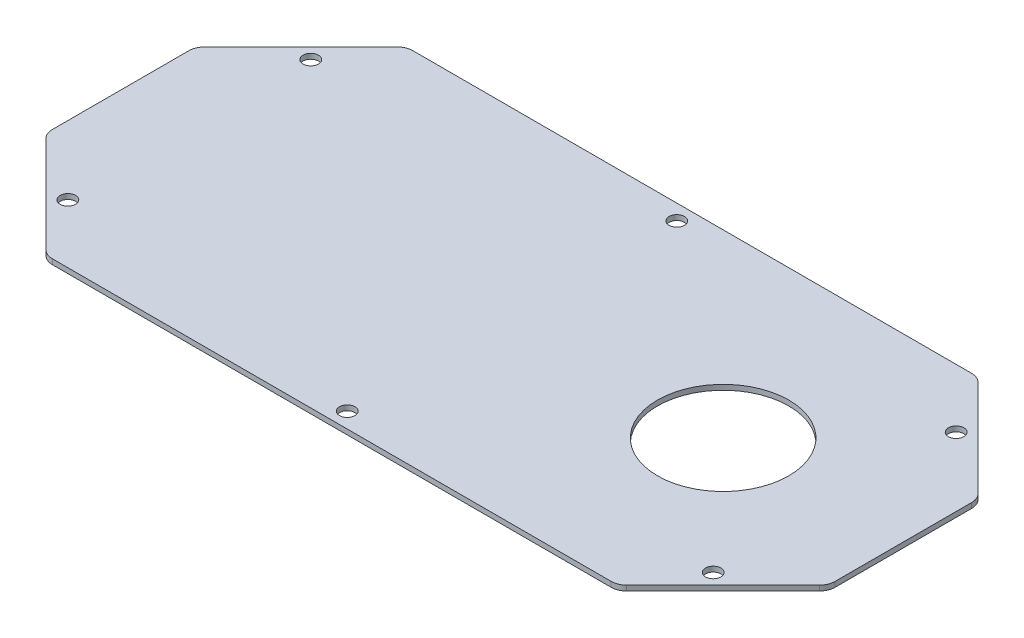
from build123d import *

# Parameters (mm, degrees)
SM_BASE_FLANGE_1_DEPTH = 1
SKETCH_2_R             = 1.5
CUT_EXTRUDE_1_DEPTH    = 10
FILLET_1_R             = 3
SKETCH_3_R             = 12.75
CUT_EXTRUDE_2_DEPTH    = 10


# Sheet-metal steps are written as plain solids
with BuildPart() as part:
    # Sketch 1 → Базовая кромка1 (new body)
    with BuildSketch(Plane(origin=(0, 0, 0), x_dir=(1, 0, 0), z_dir=(0, 1, 0))):
        Polygon((-96.502525317, -35), (14.497474683, -35), (35, -14.497474683), (35, 14.497474683), (14.497474683, 35), (-96.502525317, 35), (-117.005525317, 14.497), (-117.005525317, 0), (-117.005525317, -14.497), align=None)
    extrude(amount=-SM_BASE_FLANGE_1_DEPTH)

    # Эскиз2 → Вырез-Вытянуть1 (cut)
    with BuildSketch(Plane(origin=(0, 0, 0), x_dir=(1, 0, 0), z_dir=(0, 1, 0))):
        with Locations(Location((-103.671600061, 23.588284569, 0), (0, 0, 270))):
            Circle(SKETCH_2_R)
        with Locations(Location((-41.002525317, 32, 0), (0, 0, 270))):
            Circle(SKETCH_2_R)
        with Locations(Location((21.666312086, 23.58852191, 0), (0, 0, 270))):
            Circle(SKETCH_2_R)
        with Locations(Location((21.666312086, -23.58852191, 0), (0, 0, 270))):
            Circle(SKETCH_2_R)
        with Locations(Location((-103.671600061, -23.588284569, 0), (0, 0, 270))):
            Circle(SKETCH_2_R)
        with Locations(Location((-41.002525317, -32, 0), (0, 0, 270))):
            Circle(SKETCH_2_R)
    extrude(amount=-CUT_EXTRUDE_1_DEPTH, mode=Mode.SUBTRACT)

    # Скругление1
    fillet_1_edges = [part.edges().sort_by_distance(p)[0] for p in [
        (-117.005525317, -0.5, 14.497),
        (-117.005525317, -0.5, -14.497),
        (-96.502525317, -0.5, -35),
        (14.497474683, -0.5, -35),
        (35, -0.5, -14.497474683),
        (35, -0.5, 14.497474683),
        (14.497474683, -0.5, 35),
        (-96.502525317, -0.5, 35),
    ]]
    fillet(fillet_1_edges, radius=FILLET_1_R)

    # Эскиз3 → Вырез-Вытянуть2 (cut)
    with BuildSketch(Plane.XZ.offset(1)):
        with Locations(Location((0, 0, 0), (0, 0, 270))):
            Circle(SKETCH_3_R)
    extrude(amount=-CUT_EXTRUDE_2_DEPTH, mode=Mode.SUBTRACT)


solid = part.part
